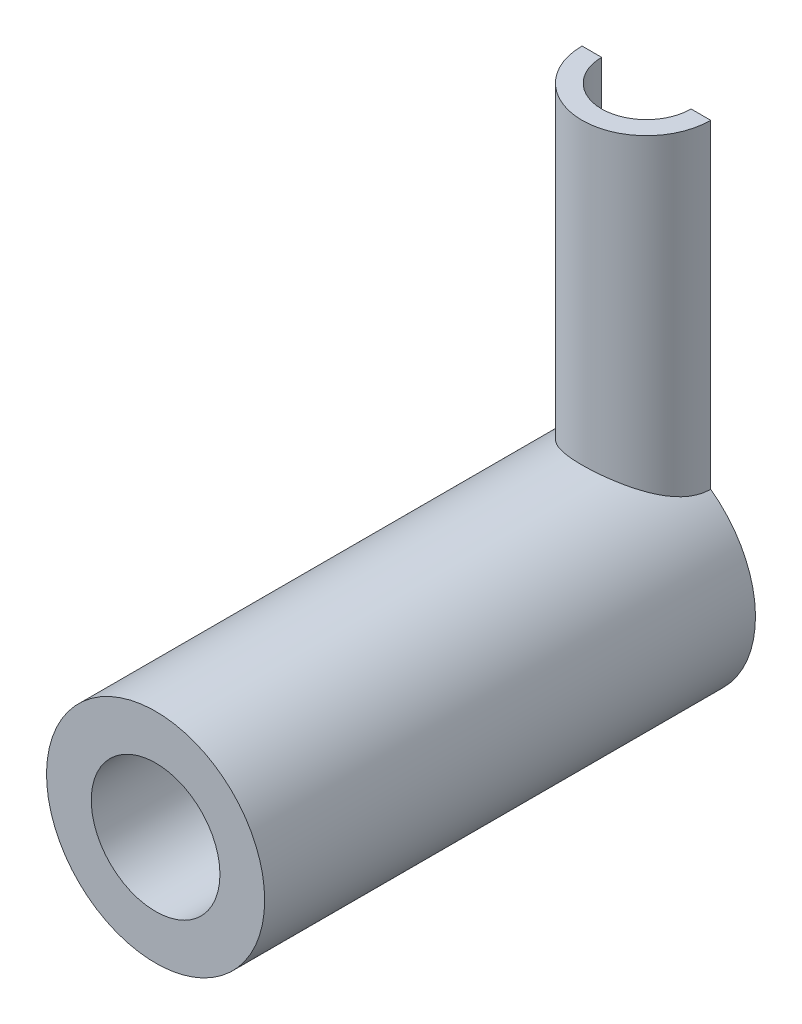
from build123d import *
from build123d.topology import SkipClean

# Parameters (mm, degrees)
SKETCH1_R           = 5
SKETCH1_R_2         = 2.95
BOSS_EXTRUDE1_DEPTH = 2.5
SKETCH2_R           = 5
SKETCH2_R_2         = 2.95
BOSS_EXTRUDE2_DEPTH = 20
SKETCH7_W           = 2.95
SKETCH7_H           = 18.687164731
REVOLVE7_ANGLE      = 180
SKETCH8_W           = 2.05
SKETCH8_H           = 20
SKETCH9_R           = 2.95
CUT_EXTRUDE1_DEPTH  = 5


with BuildPart() as part:
    # Sketch1 → Boss-Extrude1 (new body)
    with BuildSketch(Plane.XY):
        with Locations((102.341205301, 36.416113389)):
            Circle(SKETCH1_R)
        with Locations((102.341205301, 36.416113389)):
            Circle(SKETCH1_R_2, mode=Mode.SUBTRACT)
    extrude(amount=BOSS_EXTRUDE1_DEPTH)

    # Sketch2 → Boss-Extrude2 (add)
    with BuildSketch(Plane.XY.offset(2.5)):
        with Locations((102.341205301, 36.416113389)):
            Circle(SKETCH2_R)
        with Locations((102.341205301, 36.416113389)):
            Circle(SKETCH2_R_2, mode=Mode.SUBTRACT)
    extrude(amount=BOSS_EXTRUDE2_DEPTH)

    # Sketch7 → Revolve7 (revolve)
    with BuildSketch(Plane(origin=(0, 0, 0), x_dir=(-1, 0, 0), z_dir=(0, 0, -1))):
        with Locations((-103.816205301, 45.759695755)):
            Rectangle(SKETCH7_W, SKETCH7_H)
    revolve(axis=Axis((102.341205301, 36.416113389, 0), (0, -1, 0)), revolution_arc=REVOLVE7_ANGLE)

    # Sketch8 → Cut-Revolve2 (revolve, cut)
    with BuildSketch(Plane(origin=(0, 0, 0), x_dir=(-1, 0, 0), z_dir=(0, 0, -1))):
        with Locations((-103.366205301, 46.416113389)):
            Rectangle(SKETCH8_W, SKETCH8_H)
    revolve(axis=Axis((102.341205301, 36.416113389, 0), (0, 1, 0)), mode=Mode.SUBTRACT)

    # Sketch9 → Cut-Extrude1 (cut)
    with SkipClean():  # the faces are left unmerged after this step: merging them gives an invalid solid
        with BuildSketch(Plane(origin=(0, 0, 0), x_dir=(-1, 0, 0), z_dir=(0, 0, -1))):
            with Locations((-102.341205301, 36.416113389)):
                Circle(SKETCH9_R)
        extrude(amount=-CUT_EXTRUDE1_DEPTH, mode=Mode.SUBTRACT)


solid = part.part
